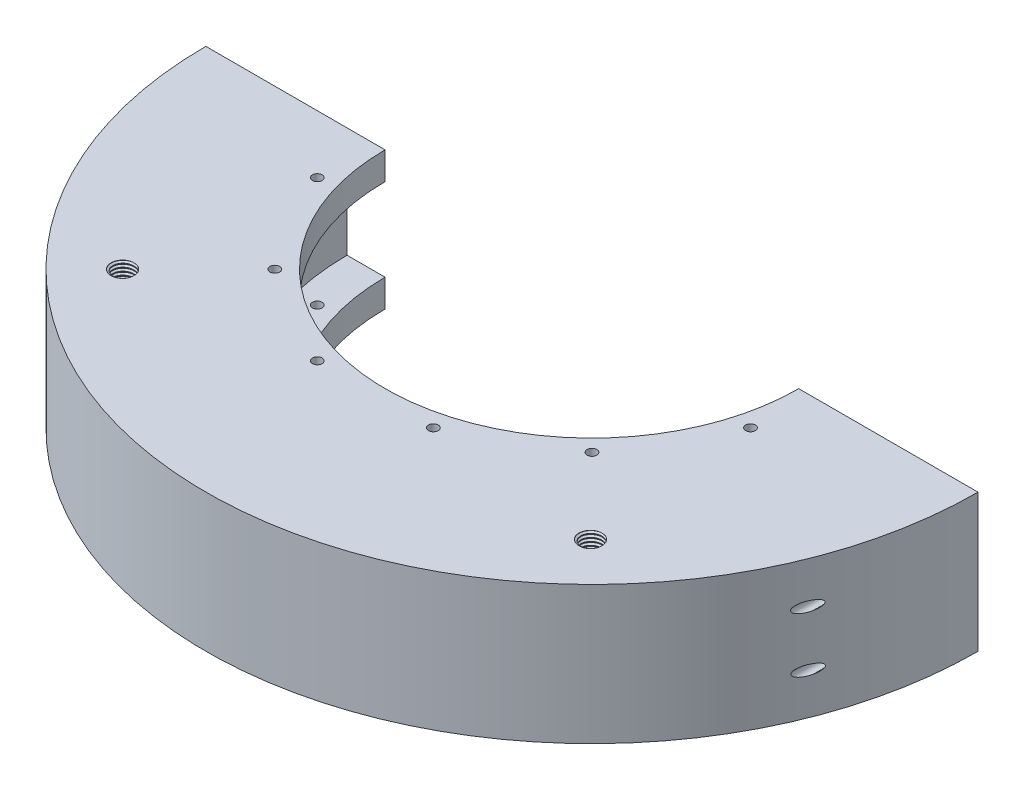
from build123d import *

# Parameters (mm, degrees)
REVOLVE1_ANGLE                 = 180
TAP_DRILL_FOR_4_40_TAP1_D      = 2.2606
CIRPATTERN1_COUNT              = 12
CUT_EXTRUDE1_REACH             = 128.722
CUT_EXTRUDE1_END_RADIUS        = 88.9
SKETCH4_R                      = 1.1303
CUT_EXTRUDE2_REACH             = 128.722
CUT_EXTRUDE2_END_RADIUS        = 88.9
SKETCH6_R                      = 1.1303
CUT_EXTRUDE2_DIRECTION_2_DEPTH = 127.721883129
SKETCH8_R                      = 2.413
CUT_EXTRUDE4_DEPTH             = 12.7
THREAD1_PITCH                  = 0.79375
THREAD2_PITCH                  = 0.79375


with BuildPart() as part:
    # Sketch1 → Revolve1 (revolve)
    with BuildSketch(Plane.XY):
        Polygon((56.388, 0), (56.388, 9.525), (47.625, 9.525), (47.625, 15.875), (88.9, 15.875), (88.9, -15.875), (47.625, -15.875), (47.625, -9.525), (56.388, -9.525), align=None)
    revolve(axis=Axis((0, 22.539286723, 0), (0, -1, 0)), revolution_arc=REVOLVE1_ANGLE)

    # Tap Drill for #4-40 Tap1 (through all)
    with Locations(Plane(origin=(49.878671003, 15.875, 13.364949615), x_dir=(0, 0, 1), z_dir=(0, 1, 0))):
        with Locations((0, 0)):
            tap_drill_for_4_40_tap1 = Hole(TAP_DRILL_FOR_4_40_TAP1_D / 2)

    # CirPattern1: Tap Drill for #4-40 Tap1 ×12 about axis, 6 skipped
    cirpattern1_axis = Axis((0, 15.875, 0), (0, 1, 0))
    add([tap_drill_for_4_40_tap1.rotate(cirpattern1_axis, i * 360 / CIRPATTERN1_COUNT) for i in range(1, CIRPATTERN1_COUNT) if i not in (1, 2, 3, 4, 5, 6)], mode=Mode.SUBTRACT)

    # Cut-Extrude1: up to this cylinder (the profile starts inside it)
    cut_extrude1_end = Plane(origin=(0, 0, 0), z_dir=(0, 1, 0)) * Cylinder(CUT_EXTRUDE1_END_RADIUS, 448.944, mode=Mode.PRIVATE)
    # Sketch4 → Cut-Extrude1 (cut, up to the surface)
    with BuildSketch(Plane(origin=(0, 0, 0), x_dir=(-1, 0, 0), z_dir=(0, 0, -1)), mode=Mode.PRIVATE) as cut_extrude1_sk1:
        with Locations((82.55, 6.35)):
            Circle(SKETCH4_R)
    cut_extrude1_tool1 = extrude(cut_extrude1_sk1.sketch, amount=-CUT_EXTRUDE1_REACH, mode=Mode.PRIVATE) & cut_extrude1_end
    add(cut_extrude1_tool1.solids().sort_by_distance((-82.55, 6.35, 0))[0], mode=Mode.SUBTRACT)
    # Sketch4 → Cut-Extrude1 (cut, up to the surface)
    with BuildSketch(Plane(origin=(0, 0, 0), x_dir=(-1, 0, 0), z_dir=(0, 0, -1)), mode=Mode.PRIVATE) as cut_extrude1_sk2:
        with Locations((82.55, -6.35)):
            Circle(SKETCH4_R)
    cut_extrude1_tool2 = extrude(cut_extrude1_sk2.sketch, amount=-CUT_EXTRUDE1_REACH, mode=Mode.PRIVATE) & cut_extrude1_end
    add(cut_extrude1_tool2.solids().sort_by_distance((-82.55, -6.35, 0))[0], mode=Mode.SUBTRACT)

    # Cut-Extrude2: up to this cylinder (the profile starts inside it)
    cut_extrude2_end = Plane(origin=(0, 0, 0), z_dir=(0, 1, 0)) * Cylinder(CUT_EXTRUDE2_END_RADIUS, 448.944, mode=Mode.PRIVATE)
    # Sketch6 → Cut-Extrude2 (cut, up to the surface)
    with BuildSketch(Plane(origin=(0, 0, 0), x_dir=(-1, 0, 0), z_dir=(0, 0, -1)), mode=Mode.PRIVATE) as cut_extrude2_sk1:
        with Locations((-82.55, 6.35)):
            Circle(SKETCH6_R)
    cut_extrude2_tool1 = extrude(cut_extrude2_sk1.sketch, amount=-CUT_EXTRUDE2_REACH, mode=Mode.PRIVATE) & cut_extrude2_end
    add(cut_extrude2_tool1.solids().sort_by_distance((82.55, 6.35, 0))[0], mode=Mode.SUBTRACT)
    # Sketch6 → Cut-Extrude2 (cut, up to the surface)
    with BuildSketch(Plane(origin=(0, 0, 0), x_dir=(-1, 0, 0), z_dir=(0, 0, -1)), mode=Mode.PRIVATE) as cut_extrude2_sk2:
        with Locations((-82.579243869, -6.35)):
            Circle(SKETCH6_R)
    cut_extrude2_tool2 = extrude(cut_extrude2_sk2.sketch, amount=-CUT_EXTRUDE2_REACH, mode=Mode.PRIVATE) & cut_extrude2_end
    add(cut_extrude2_tool2.solids().sort_by_distance((82.579244, -6.35, 0))[0], mode=Mode.SUBTRACT)

    # Sketch6 → Cut-Extrude2 direction 2 (cut)
    with BuildSketch(Plane(origin=(0, 0, 0), x_dir=(-1, 0, 0), z_dir=(0, 0, -1))):
        with Locations((-82.55, 6.35)):
            Circle(SKETCH6_R)
        with Locations((-82.579243869, -6.35)):
            Circle(SKETCH6_R)
    extrude(amount=CUT_EXTRUDE2_DIRECTION_2_DEPTH, mode=Mode.SUBTRACT)

    # Sketch8 → Cut-Extrude4 (cut)
    with BuildSketch(Plane(origin=(0, 15.875, 0), x_dir=(1, 0, 0), z_dir=(0, 1, 0))):
        with Locations(Location((53.881536726, -53.881536726, 0), (0, 0, 270))):
            Circle(SKETCH8_R)
        with Locations(Location((-53.881536726, -53.881536726, 0), (0, 0, 270))):
            Circle(SKETCH8_R)
    extrude(amount=-CUT_EXTRUDE4_DEPTH, mode=Mode.SUBTRACT)

    # Thread1: arcs per turn and ends read off the stored shape
    # Thread1: the profile of Thread Profile2 profile screwed along a right-hand helix through 16 turns, 8 arcs to a turn; built about Z, then put on its axis
    thread1_z = Axis((0, 0, 0), (0, 0, 1))
    thread1_corners = [(2.4127, 0, -0.000173205), (2.842629789, 0, 0.248046874), (2.842629789, 0, 0.347265624), (2.4127, 0, 0.595485703)]
    with BuildLine(mode=Mode.PRIVATE) as thread1_profile:
        Line(thread1_corners[0], thread1_corners[1])
        Line(thread1_corners[1], thread1_corners[2])
        Line(thread1_corners[2], thread1_corners[3])
        Line(thread1_corners[3], thread1_corners[0])
    thread1_cap = Face(thread1_profile.wire())
    thread1_turn_angles = [0, 22.5, 45, 67.5, 90, 112.5, 135, 157.5, 180, 202.5, 225, 247.5, 270, 292.5, 315, 337.5, 360]
    thread1_turn_weights = [1, 0.9238795325112867, 1, 0.9238795325112867, 1, 0.9238795325112867, 1, 0.9238795325112867, 1, 0.9238795325112867, 1, 0.9238795325112867, 1, 0.9238795325112867, 1, 0.9238795325112867, 1]
    thread1_turn_rails = [Edge.make_bspline([Vector(p[0], p[1], 0).rotate(thread1_z, thread1_turn_angles[k]) / thread1_turn_weights[k] + Vector(0, 0, p[2] + THREAD1_PITCH * thread1_turn_angles[k] / 360) for k in range(17)], [0, 0, 0, 1, 1, 2, 2, 3, 3, 4, 4, 5, 5, 6, 6, 7, 7, 8, 8, 8], 2, thread1_turn_weights) for p in thread1_corners]
    thread1_turn_sides = [Face.make_surface_from_curves(thread1_turn_rails[p[0]], thread1_turn_rails[p[1]]) for p in [(0, 1), (1, 2), (2, 3), (3, 0)]]
    thread1 = Plane(origin=(53.881536726, 3.175, 53.881536726), x_dir=(1, 0, 0), z_dir=(0, 1, 0)) * Solid(Shell([*[p.moved(Location((0, 0, THREAD1_PITCH * i))) for i in range(16) for p in thread1_turn_sides], thread1_cap, thread1_cap.rotate(thread1_z, 5760).moved(Location((0, 0, THREAD1_PITCH * 5760 / 360)))]))
    add(thread1, mode=Mode.SUBTRACT)

    # Thread2: arcs per turn and ends read off the stored shape
    # Thread2: the profile of Thread Profile3 profile screwed along a right-hand helix through 16 turns, 8 arcs to a turn; built about Z, then put on its axis
    thread2_z = Axis((0, 0, 0), (0, 0, 1))
    thread2_corners = [(2.4127, 0, -0.000173205), (2.842629788, 0, 0.248046874), (2.842629788, 0, 0.347265624), (2.4127, 0, 0.595485703)]
    with BuildLine(mode=Mode.PRIVATE) as thread2_profile:
        Line(thread2_corners[0], thread2_corners[1])
        Line(thread2_corners[1], thread2_corners[2])
        Line(thread2_corners[2], thread2_corners[3])
        Line(thread2_corners[3], thread2_corners[0])
    thread2_cap = Face(thread2_profile.wire())
    thread2_turn_angles = [0, 22.5, 45, 67.5, 90, 112.5, 135, 157.5, 180, 202.5, 225, 247.5, 270, 292.5, 315, 337.5, 360]
    thread2_turn_weights = [1, 0.9238795325112867, 1, 0.9238795325112867, 1, 0.9238795325112867, 1, 0.9238795325112867, 1, 0.9238795325112867, 1, 0.9238795325112867, 1, 0.9238795325112867, 1, 0.9238795325112867, 1]
    thread2_turn_rails = [Edge.make_bspline([Vector(p[0], p[1], 0).rotate(thread2_z, thread2_turn_angles[k]) / thread2_turn_weights[k] + Vector(0, 0, p[2] + THREAD2_PITCH * thread2_turn_angles[k] / 360) for k in range(17)], [0, 0, 0, 1, 1, 2, 2, 3, 3, 4, 4, 5, 5, 6, 6, 7, 7, 8, 8, 8], 2, thread2_turn_weights) for p in thread2_corners]
    thread2_turn_sides = [Face.make_surface_from_curves(thread2_turn_rails[p[0]], thread2_turn_rails[p[1]]) for p in [(0, 1), (1, 2), (2, 3), (3, 0)]]
    thread2 = Plane(origin=(-53.881536726, 3.175, 53.881536726), x_dir=(1, 0, 0), z_dir=(0, 1, 0)) * Solid(Shell([*[p.moved(Location((0, 0, THREAD2_PITCH * i))) for i in range(16) for p in thread2_turn_sides], thread2_cap, thread2_cap.rotate(thread2_z, 5760).moved(Location((0, 0, THREAD2_PITCH * 5760 / 360)))]))
    add(thread2, mode=Mode.SUBTRACT)


solid = part.part
